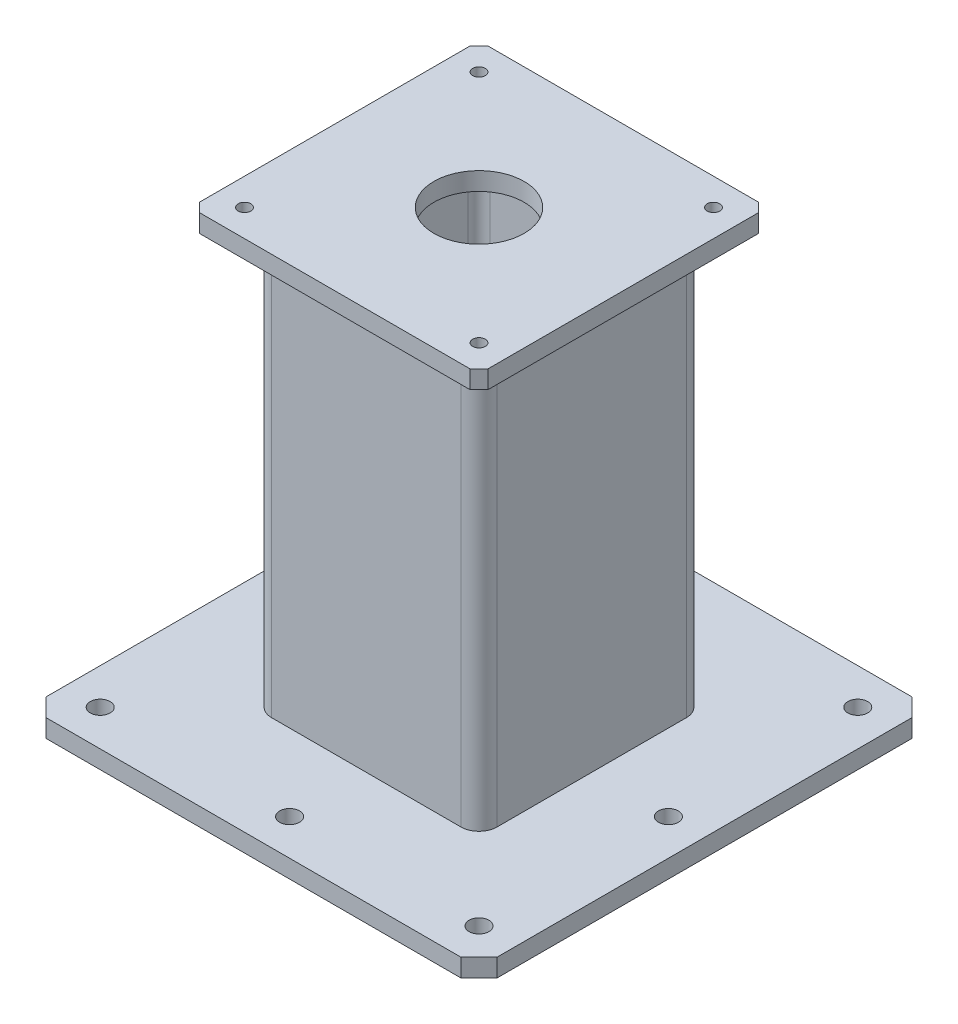
from build123d import *

# Parameters (mm, degrees)
SKETCH_1_W                       = 320
SKETCH_1_H                       = 320
EXTRUDE_1_DEPTH                  = 20
SKETCH_2_R                       = 50
CUT_EXTRUDE_1_DEPTH              = 20
CHAMFER_1_SIZE                   = 10
MEMBER_1_DEPTH                   = 460
SKETCH_15_W                      = 500
SKETCH_15_H                      = 500
EXTRUDE_6_DEPTH                  = 20
CHAMFER_3_SIZE                   = 20
HOLE_WIZARD_22_0_22_2_AT_2_COUNT = 2
HOLE_WIZARD_22_0_22_2_AT_2_PITCH = 420
HOLE_WIZARD_22_0_22_2_AT_3_COUNT = 2
HOLE_WIZARD_22_0_22_2_AT_3_PITCH = 420
HOLE_WIZARD_22_0_22_2_AT_4_COUNT = 2
HOLE_WIZARD_22_0_22_2_AT_4_PITCH = 593.969696197
HOLE_WIZARD_22_0_22_2_AT_5_COUNT = 2
HOLE_WIZARD_22_0_22_2_AT_5_PITCH = 210
HOLE_WIZARD_22_0_22_2_AT_6_COUNT = 2
HOLE_WIZARD_22_0_22_2_AT_6_PITCH = 469.574275275
HOLE_WIZARD_22_0_22_2_AT_7_COUNT = 2
HOLE_WIZARD_22_0_22_2_AT_7_PITCH = 469.574275275
HOLE_WIZARD_22_0_22_2_AT_8_COUNT = 2
HOLE_WIZARD_22_0_22_2_AT_8_PITCH = 210
SKETCH_18_R                      = 100
CUT_EXTRUDE_4_DEPTH              = 20
HOLE_WIZARD_M16_2_OUTLINE_R      = 7
HOLE_WIZARD_M16_2_DEPTH          = 20


# Read off the part's stored shape, not the designer's step: M16 螺纹孔2
with BuildPart() as part:
    # 草图1 → 凸台-拉伸1 (new body)
    with BuildSketch(Plane(origin=(0, 0, 0), x_dir=(1, 0, 0), z_dir=(0, 1, 0))):
        Rectangle(SKETCH_1_W, SKETCH_1_H)
    extrude(amount=EXTRUDE_1_DEPTH)

    # 草图2 → 切除-拉伸1 (cut)
    with BuildSketch(Plane(origin=(0, 20, 0), x_dir=(1, 0, 0), z_dir=(0, 1, 0))):
        with Locations(Location((0, 0, 0), (0, 0, 270))):
            Circle(SKETCH_2_R)
    extrude(amount=-CUT_EXTRUDE_1_DEPTH, mode=Mode.SUBTRACT)

    # 倒角1
    chamfer_1_edges = [part.edges().sort_by_distance(p)[0] for p in [
        (-160, 10, -160),
        (160, 10, -160),
        (160, 10, 160),
        (-160, 10, 160),
    ]]
    chamfer(chamfer_1_edges, length=CHAMFER_1_SIZE)

    # M16 螺纹孔2 outline → M16 螺纹孔2 (cut)
    with BuildSketch(Plane(origin=(0, 0, 0), x_dir=(1, 0, 0), z_dir=(0, 1, 0))):
        with Locations((130, 130)):
            Circle(HOLE_WIZARD_M16_2_OUTLINE_R)
        with Locations((-130, -130)):
            Circle(HOLE_WIZARD_M16_2_OUTLINE_R)
        with Locations((-130, 130)):
            Circle(HOLE_WIZARD_M16_2_OUTLINE_R)
        with Locations((130, -130)):
            Circle(HOLE_WIZARD_M16_2_OUTLINE_R)
    extrude(amount=HOLE_WIZARD_M16_2_DEPTH, mode=Mode.SUBTRACT)


with BuildPart() as body_2:
    # Sketch11 → Member 1 (new body)
    with BuildSketch(Plane(origin=(0, 0, 0), x_dir=(0, 0, -1), z_dir=(0, -1, 0))):
        with BuildLine():
            Line((-105, -125), (105, -125))
            ThreePointArc((105, -125), (119.142135624, -119.142135624), (125, -105))
            Line((125, -105), (125, 105))
            ThreePointArc((125, 105), (119.142135624, 119.142135624), (105, 125))
            Line((105, 125), (-105, 125))
            ThreePointArc((-105, 125), (-119.142135624, 119.142135624), (-125, 105))
            Line((-125, 105), (-125, -105))
            ThreePointArc((-125, -105), (-119.142135624, -119.142135624), (-105, -125))
        make_face()
        with BuildLine():
            Line((-105, -117), (105, -117))
            ThreePointArc((105, -117), (113.485281374, -113.485281374), (117, -105))
            Line((117, -105), (117, 105))
            ThreePointArc((117, 105), (113.485281374, 113.485281374), (105, 117))
            Line((105, 117), (-105, 117))
            ThreePointArc((-105, 117), (-113.485281374, 113.485281374), (-117, 105))
            Line((-117, 105), (-117, -105))
            ThreePointArc((-117, -105), (-113.485281374, -113.485281374), (-105, -117))
        make_face(mode=Mode.SUBTRACT)
    extrude(amount=MEMBER_1_DEPTH)


with BuildPart() as body_3:
    # 草图15 → 凸台-拉伸6 (new body)
    with BuildSketch(Plane.XZ.offset(460)):
        Rectangle(SKETCH_15_W, SKETCH_15_H)
    extrude(amount=EXTRUDE_6_DEPTH)

    # 倒角3
    chamfer_3_edges = [body_3.edges().sort_by_distance(p)[0] for p in [
        (250, -470, -250),
        (-250, -470, -250),
        (-250, -470, 250),
        (250, -470, 250),
    ]]
    chamfer(chamfer_3_edges, length=CHAMFER_3_SIZE)

    # 草图16 → Ø22.0 (22) 直径孔2 (revolve, cut)
    with BuildSketch(Plane(origin=(-210, -460, -210), x_dir=(0, 0, 1), z_dir=(1, 0, 0))):
        Polygon((0, 0), (0, 86.609466809), (11, 80), (11, 0), align=None)
    hole_wizard_22_0_22_2 = revolve(axis=Axis((-210, -453.65, -210), (0, -1, 0)), mode=Mode.SUBTRACT)

    # Ø22.0 (22) 直径孔2 at 2: Ø22.0 (22) 直径孔2 ×2
    with Locations(*[(i * HOLE_WIZARD_22_0_22_2_AT_2_PITCH, 0, 0) for i in range(1, HOLE_WIZARD_22_0_22_2_AT_2_COUNT)]):
        add(hole_wizard_22_0_22_2, mode=Mode.SUBTRACT)

    # Ø22.0 (22) 直径孔2 at 3: Ø22.0 (22) 直径孔2 ×2
    with Locations(*[(0, 0, i * HOLE_WIZARD_22_0_22_2_AT_3_PITCH) for i in range(1, HOLE_WIZARD_22_0_22_2_AT_3_COUNT)]):
        add(hole_wizard_22_0_22_2, mode=Mode.SUBTRACT)

    # Ø22.0 (22) 直径孔2 at 4: Ø22.0 (22) 直径孔2 ×2
    with Locations(*[Vector(0.7071067811865476, 0, 0.7071067811865476) * (i * HOLE_WIZARD_22_0_22_2_AT_4_PITCH) for i in range(1, HOLE_WIZARD_22_0_22_2_AT_4_COUNT)]):
        add(hole_wizard_22_0_22_2, mode=Mode.SUBTRACT)

    # Ø22.0 (22) 直径孔2 at 5: Ø22.0 (22) 直径孔2 ×2
    with Locations(*[(i * HOLE_WIZARD_22_0_22_2_AT_5_PITCH, 0, 0) for i in range(1, HOLE_WIZARD_22_0_22_2_AT_5_COUNT)]):
        add(hole_wizard_22_0_22_2, mode=Mode.SUBTRACT)

    # Ø22.0 (22) 直径孔2 at 6: Ø22.0 (22) 直径孔2 ×2
    with Locations(*[Vector(0.4472135954999578, 0, 0.894427190999916) * (i * HOLE_WIZARD_22_0_22_2_AT_6_PITCH) for i in range(1, HOLE_WIZARD_22_0_22_2_AT_6_COUNT)]):
        add(hole_wizard_22_0_22_2, mode=Mode.SUBTRACT)

    # Ø22.0 (22) 直径孔2 at 7: Ø22.0 (22) 直径孔2 ×2
    with Locations(*[Vector(0.8944271909999159, 0, 0.447213595499958) * (i * HOLE_WIZARD_22_0_22_2_AT_7_PITCH) for i in range(1, HOLE_WIZARD_22_0_22_2_AT_7_COUNT)]):
        add(hole_wizard_22_0_22_2, mode=Mode.SUBTRACT)

    # Ø22.0 (22) 直径孔2 at 8: Ø22.0 (22) 直径孔2 ×2
    with Locations(*[(0, 0, i * HOLE_WIZARD_22_0_22_2_AT_8_PITCH) for i in range(1, HOLE_WIZARD_22_0_22_2_AT_8_COUNT)]):
        add(hole_wizard_22_0_22_2, mode=Mode.SUBTRACT)

    # 草图18 → 切除-拉伸4 (cut)
    with BuildSketch(Plane.XZ.offset(480)):
        with Locations(Location((0, 0, 0), (0, 0, 270))):
            Circle(SKETCH_18_R)
    extrude(amount=-CUT_EXTRUDE_4_DEPTH, mode=Mode.SUBTRACT)


solid = Compound([part.part, body_2.part, body_3.part])
